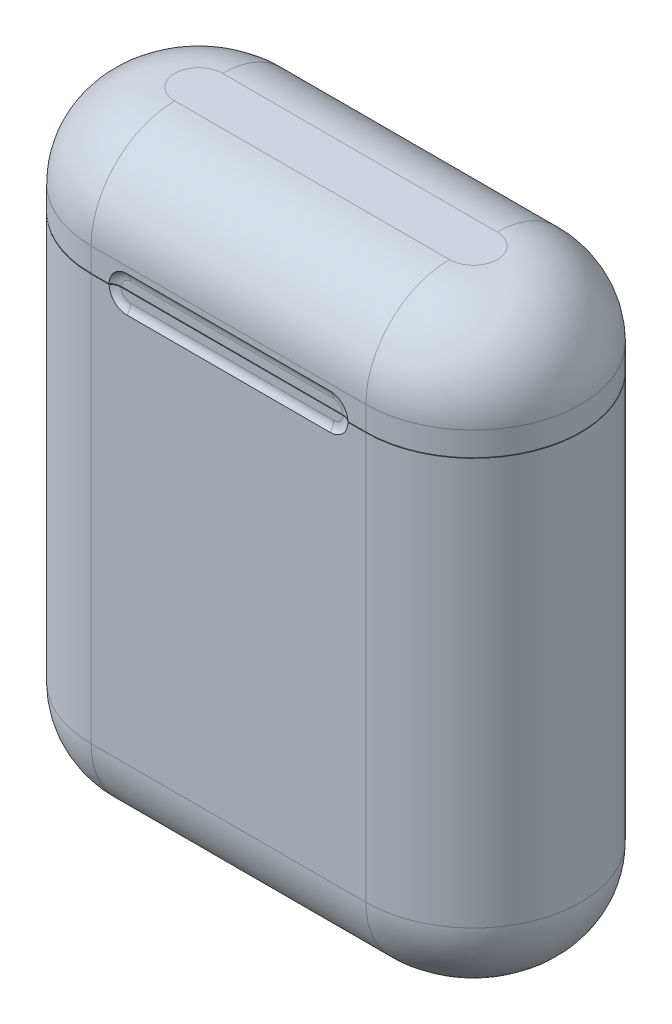
from build123d import *

# Parameters (mm, degrees)
BOSS_EXTRUDE1_DEPTH          = 127
BOSS_EXTRUDE1_DEPTH_BACK     = 0.254
FILLET1_R                    = 17.78
CUT_EXTRUDE1_DEPTH           = 0.762
FILLET4_R                    = 2.54
SKETCH6_W                    = 0.127
SKETCH6_H                    = 0.127
CUT_EXTRUDE2_DEPTH           = 1.27
CUT_EXTRUDE3_DEPTH           = 13.97
CUT_EXTRUDE_THIN2_DEPTH      = 1.27
SKETCH12_R                   = 7.195350236
SKETCH12_R_2                 = 7.068350236
CUT_EXTRUDE_THIN3_DEPTH      = 1.27
CUT_EXTRUDE_THIN4_DEPTH      = 145.674128024
CUT_EXTRUDE_THIN4_DEPTH_BACK = 1.27
CUT_EXTRUDE_THIN5_START      = -1.27
CUT_EXTRUDE_THIN5_DEPTH      = 1.27


# Read off the part's stored shape, not the designer's step: Cut-Extrude-Thin5
with BuildPart() as part:
    # Sketch1 → Boss-Extrude1 (new, two sides: drawn at the far end of the back side and taken through both)
    with BuildSketch(Plane(origin=(0, 0, 0), x_dir=(1, 0, 0), z_dir=(0, 1, 0)).offset(-BOSS_EXTRUDE1_DEPTH_BACK)):
        with BuildLine():
            Line((-29.21, 45.72), (29.21, 45.72))
            ThreePointArc((29.21, 45.72), (52.07, 22.86), (29.21, 0))
            Line((29.21, 0), (-29.21, 0))
            ThreePointArc((-29.21, 0), (-52.07, 22.86), (-29.21, 45.72))
        make_face()
    extrude(amount=BOSS_EXTRUDE1_DEPTH + BOSS_EXTRUDE1_DEPTH_BACK)

    # Fillet1
    fillet1_edges = [part.edges().sort_by_distance(p)[0] for p in [
        (-52.07, 127, -22.86),
        (52.07, -0.254, -22.86),
        (0, 127, 0),
        (52.07, 127, -22.86),
        (0, 127, -45.72),
        (0, -0.254, -45.72),
        (-52.07, -0.254, -22.86),
        (0, -0.254, 0),
    ]]
    fillet(fillet1_edges, radius=FILLET1_R)

    # Sketch2 → Cut-Extrude1 (cut)
    with BuildSketch(Plane.XY):
        with BuildLine():
            Line((-21.59, 107.889672291), (21.59, 107.889672291))
            ThreePointArc((21.59, 107.889672291), (25.4, 104.079672291), (21.59, 100.269672291))
            Line((21.59, 100.269672291), (-21.59, 100.269672291))
            ThreePointArc((-21.59, 100.269672291), (-25.4, 104.079672291), (-21.59, 107.889672291))
        make_face()
    extrude(amount=-CUT_EXTRUDE1_DEPTH, mode=Mode.SUBTRACT)

    # Fillet4
    # the kernel refuses this fillet: 2.54 mm, written as the material it adds along each edge
    with BuildSketch(Plane(origin=(-21.59, 107.889672291, -0.762), x_dir=(0, 0, 1), z_dir=(1, 0, 0)), Plane(origin=(21.59, 100.269672291, -0.762), x_dir=(0, 0, 1), z_dir=(-1, 0, 0))) as fillet4_piece_1:
        with BuildLine():
            CenterArc((2.54, 1.813922821), FILLET4_R, 180, 45.572995999)
            Line((0, 1.813922821), (-0.0508, 1.813922821))
            Line((-0.0508, 1.813922821), (-0.0508, 0))
            Line((-0.0508, 0), (0, -0.0508))
            ThreePointArc((0, -0.0508), (0.381, -0.0508), (0.72644, -0.036278456))
            Line((0.72644, -0.036278456), (0.762, 0))
        make_face()
    extrude(amount=43.18)
    with BuildSketch(Plane(origin=(-21.59, 104.079672291, -0.762), x_dir=(0, -1, 0), z_dir=(1, 0, 0))) as fillet4_piece_2:
        with BuildLine():
            CenterArc((1.996077179, -2.54), FILLET4_R, 44.427004001, 45.572995999)
            Line((1.996077179, 0), (1.996077179, 0.0508))
            Line((1.996077179, 0.0508), (3.81, 0.0508))
            Line((3.81, 0.0508), (3.8608, 0))
            ThreePointArc((3.8608, 0), (3.8608, -0.381), (3.846278456, -0.72644))
            Line((3.846278456, -0.72644), (3.81, -0.762))
        make_face()
    revolve(axis=Axis((-21.59, 104.079672291, -0.762), (0, 0, -1)), revolution_arc=180)
    with BuildSketch(Plane(origin=(21.59, 104.079672291, -0.762), x_dir=(0, 1, 0), z_dir=(-1, 0, 0))) as fillet4_piece_3:
        with BuildLine():
            CenterArc((1.996077179, -2.54), FILLET4_R, 44.427004001, 45.572995999)
            Line((1.996077179, 0), (1.996077179, 0.0508))
            Line((1.996077179, 0.0508), (3.81, 0.0508))
            Line((3.81, 0.0508), (3.8608, 0))
            ThreePointArc((3.8608, 0), (3.8608, -0.381), (3.846278456, -0.72644))
            Line((3.846278456, -0.72644), (3.81, -0.762))
        make_face()
    revolve(axis=Axis((21.59, 104.079672291, -0.762), (0, 0, -1)), revolution_arc=180)

    # Cut-Sweep1: sweep along a path in Sketch5
    with BuildLine(Plane(origin=(0, 104.079672291, 0), x_dir=(1, 0, 0), z_dir=(0, 1, 0))) as cut_sweep1_path:
        Line((29.21, 0), (-29.21, 0))
        ThreePointArc((-29.21, 0), (-52.07, 22.86), (-29.21, 45.72))
        Line((-29.21, 45.72), (29.21, 45.72))
        ThreePointArc((29.21, 45.72), (52.07, 22.86), (29.21, 0))
    # Sketch6 → Cut-Sweep1 (sweep, cut)
    with BuildSketch(Plane(origin=(-25.4, 0, 0), x_dir=(0, 0, -1), z_dir=(1, 0, 0))):
        with Locations((0.0635, 104.079672291)):
            Rectangle(SKETCH6_W, SKETCH6_H)
    sweep(path=cut_sweep1_path.line, mode=Mode.SUBTRACT)

    # Sketch7 → Cut-Extrude2 (cut)
    with BuildSketch(Plane.XY):
        Polygon((-25.122419633, 104.022143213), (25.267548773, 103.995159273), (25.267548773, 104.118254682), (-25.195208041, 104.175753334), (-25.324038117, 104.147004008), (-25.324038117, 104.02762164), align=None)
    extrude(amount=-CUT_EXTRUDE2_DEPTH, mode=Mode.SUBTRACT)

    # Sketch8 → Cut-Extrude3 (cut)
    with BuildSketch(Plane.XZ.offset(0.254)):
        with BuildLine():
            Line((-8.89, -20.32), (6.35, -20.32))
            ThreePointArc((6.35, -20.32), (8.89, -22.86), (6.35, -25.4))
            Line((6.35, -25.4), (-8.89, -25.4))
            ThreePointArc((-8.89, -25.4), (-11.43, -22.86), (-8.89, -20.32))
        make_face()
    extrude(amount=-CUT_EXTRUDE3_DEPTH, mode=Mode.SUBTRACT)

    # Sketch11 → Cut-Extrude-Thin2 (cut)
    # profile 1 of 2: a face of its own
    with BuildSketch(Plane.XZ.offset(0.254)):
        with BuildLine():
            Line((6.35, -26.191590562), (-8.89, -26.191590562))
            ThreePointArc((-8.89, -26.191590562), (-12.221590562, -22.86), (-8.89, -19.528409438))
            Line((-8.89, -19.528409438), (6.35, -19.528409438))
            ThreePointArc((6.35, -19.528409438), (9.681590562, -22.86), (6.35, -26.191590562))
        make_face()
        with BuildLine():
            Line((6.35, -26.064590562), (-8.89, -26.064590562))
            ThreePointArc((-8.89, -26.064590562), (-12.094590562, -22.86), (-8.89, -19.655409438))
            Line((-8.89, -19.655409438), (6.35, -19.655409438))
            ThreePointArc((6.35, -19.655409438), (9.554590562, -22.86), (6.35, -26.064590562))
        make_face(mode=Mode.SUBTRACT)
    # profile 2 of 2: a face of its own
    with BuildSketch(Plane.XZ.offset(0.254)):
        with BuildLine():
            Line((6.35, -25.504216871), (-8.89, -25.504216871))
            ThreePointArc((-8.89, -25.504216871), (-11.534216871, -22.86), (-8.89, -20.215783129))
            Line((-8.89, -20.215783129), (6.35, -20.215783129))
            ThreePointArc((6.35, -20.215783129), (8.994216871, -22.86), (6.35, -25.504216871))
        make_face()
        with BuildLine():
            Line((6.35, -25.377216871), (-8.89, -25.377216871))
            ThreePointArc((-8.89, -25.377216871), (-11.407216871, -22.86), (-8.89, -20.342783129))
            Line((-8.89, -20.342783129), (6.35, -20.342783129))
            ThreePointArc((6.35, -20.342783129), (8.867216871, -22.86), (6.35, -25.377216871))
        make_face(mode=Mode.SUBTRACT)
    extrude(amount=-CUT_EXTRUDE_THIN2_DEPTH, mode=Mode.SUBTRACT)

    # Sketch12 → Cut-Extrude-Thin3 (cut)
    with BuildSketch(Plane(origin=(0, 0, -45.72), x_dir=(-1, 0, 0), z_dir=(0, 0, -1))):
        with Locations((0, 30.473742862)):
            Circle(SKETCH12_R)
        with Locations((0, 30.473742862)):
            Circle(SKETCH12_R_2, mode=Mode.SUBTRACT)
    extrude(amount=-CUT_EXTRUDE_THIN3_DEPTH, mode=Mode.SUBTRACT)

    # Sketch13 → Cut-Extrude-Thin4 (cut, two sides: drawn at the far end of the back side and taken through both)
    with BuildSketch(Plane(origin=(0, 0, -45.72), x_dir=(-1, 0, 0), z_dir=(0, 0, -1)).offset(-CUT_EXTRUDE_THIN4_DEPTH_BACK)):
        with BuildLine():
            Line((-20.32, 104.016172291), (-20.32, 101.476172291))
            ThreePointArc((-20.32, 101.476172291), (-19.576051224, 99.680121067), (-17.78, 98.936172291))
            Line((-17.78, 98.936172291), (17.78, 98.936172291))
            ThreePointArc((17.78, 98.936172291), (19.576051224, 99.680121067), (20.32, 101.476172291))
            Line((20.32, 101.476172291), (20.32, 104.016172291))
            Line((20.32, 104.016172291), (20.193, 104.016172291))
            Line((20.193, 104.016172291), (20.193, 101.476172291))
            ThreePointArc((20.193, 101.476172291), (19.486248663, 99.769923628), (17.78, 99.063172291))
            Line((17.78, 99.063172291), (-17.78, 99.063172291))
            ThreePointArc((-17.78, 99.063172291), (-19.486248663, 99.769923628), (-20.193, 101.476172291))
            Line((-20.193, 101.476172291), (-20.193, 104.016172291))
            Line((-20.193, 104.016172291), (-20.32, 104.016172291))
        make_face()
    extrude(amount=CUT_EXTRUDE_THIN4_DEPTH + CUT_EXTRUDE_THIN4_DEPTH_BACK, mode=Mode.SUBTRACT)

    # Cut-Extrude-Thin5 outline → Cut-Extrude-Thin5 (cut)
    with BuildSketch(Plane(origin=(0, 0, -45.72), x_dir=(-1, 0, 0), z_dir=(0, 0, -1)).offset(CUT_EXTRUDE_THIN5_START)):
        Polygon((-15.3924, 104.041572291), (-15.3924, 99.063172291), (-15.367, 99.063172291), (-15.367, 104.016172291), (-15.3416, 104.016172291), (-15.3416, 99.063172291), (-15.3162, 99.063172291), (-15.3162, 104.041572291), align=None)
        Polygon((15.3416, 99.063172291), (15.3416, 104.016172291), (15.367, 104.016172291), (15.367, 99.063172291), (15.3924, 99.063172291), (15.3924, 104.041572291), (15.3162, 104.041572291), (15.3162, 99.063172291), align=None)
    extrude(amount=CUT_EXTRUDE_THIN5_DEPTH, mode=Mode.SUBTRACT)


solid = part.part
